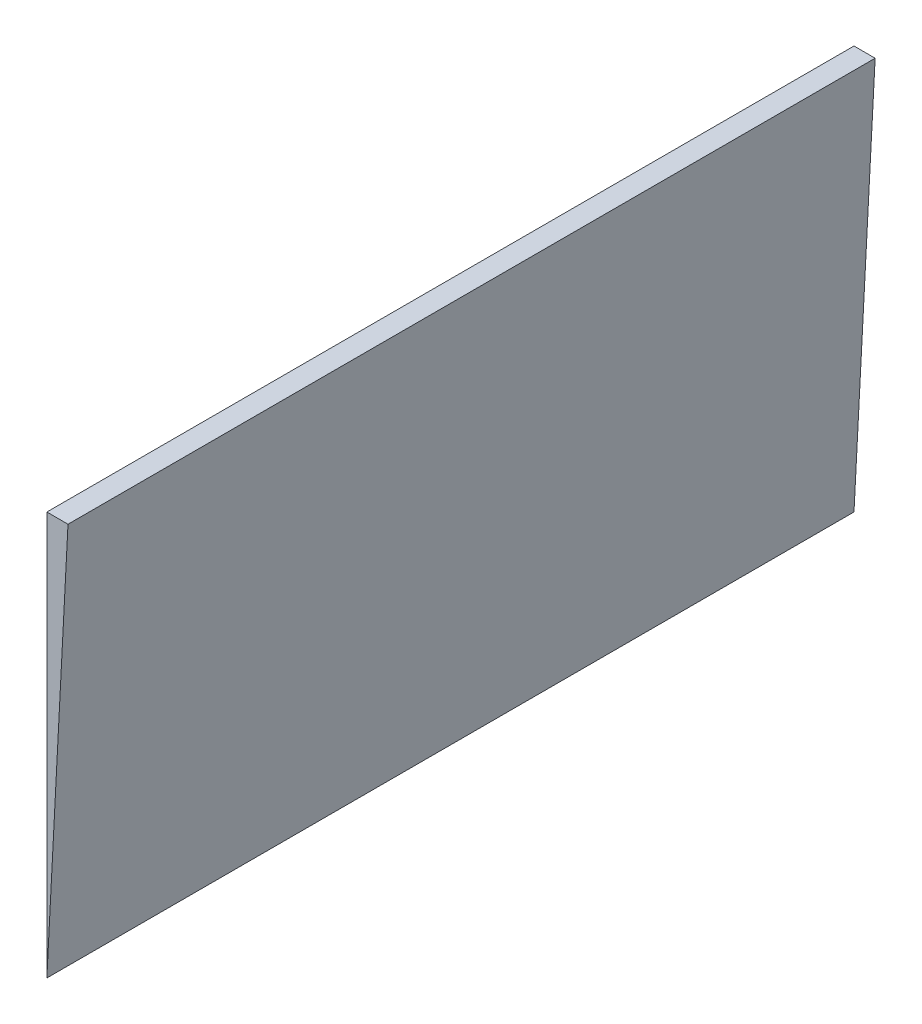
from build123d import *

# Parameters (mm, degrees)
BOSS_EXTRUDE1_DEPTH = 50


with BuildPart() as part:
    # Sketch1 → Boss-Extrude1 (new body)
    with BuildSketch(Plane.XY):
        Polygon((0, 25), (0, 0), (1.310194482, 25), align=None)
    extrude(amount=BOSS_EXTRUDE1_DEPTH)


solid = part.part
